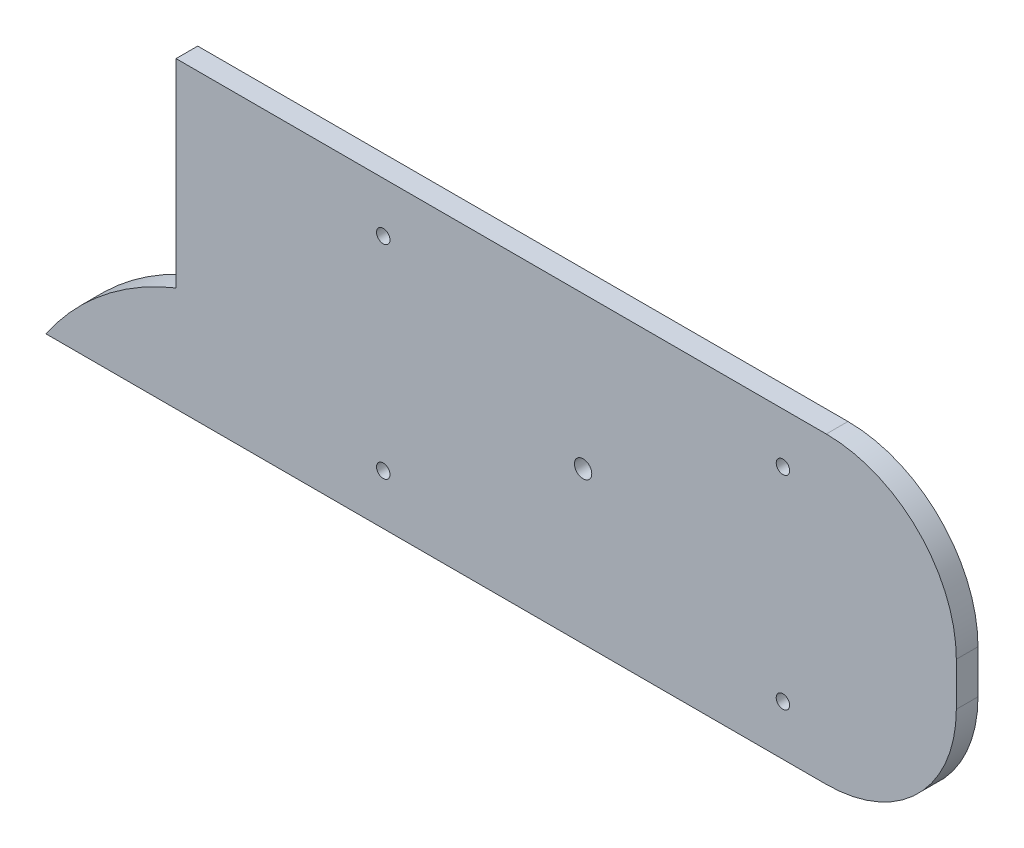
from build123d import *

# Parameters (mm, degrees)
BOSS_EXTRUDE1_DEPTH = 12.7
SKETCH4_R           = 5.08
SKETCH4_R_2         = 3.937
CUT_EXTRUDE2_DEPTH  = 563.396381567


with BuildPart() as part:
    # Sketch2 → Boss-Extrude1 (new body)
    with BuildSketch(Plane.XY):
        with BuildLine():
            Line((0, 0), (457.2, 0))
            ThreePointArc((457.2, 0), (511.081536726, 22.318463274), (533.4, 76.2))
            Line((533.4, 76.2), (533.4, 101.6))
            ThreePointArc((533.4, 101.6), (511.081536726, 155.481536726), (457.2, 177.8))
            Line((457.2, 177.8), (152.4, 177.8))
            Line((152.4, 177.8), (76.2, 177.8))
            Line((76.2, 177.8), (76.2, 61.401251199))
            ThreePointArc((76.2, 61.401251199), (33.506060073, 36.401783403), (0, 0))
        make_face()
    extrude(amount=BOSS_EXTRUDE1_DEPTH)

    # Sketch4 → Cut-Extrude2 (cut, through all)
    with BuildSketch(Plane.XY.offset(12.7)):
        with Locations((314.706, 88.9)):
            Circle(SKETCH4_R)
        with Locations((431.8, 148.4376)):
            Circle(SKETCH4_R_2)
        with Locations((197.612, 148.4376)):
            Circle(SKETCH4_R_2)
        with Locations((197.612, 29.3624)):
            Circle(SKETCH4_R_2)
        with Locations((431.8, 29.3624)):
            Circle(SKETCH4_R_2)
    extrude(amount=-CUT_EXTRUDE2_DEPTH, mode=Mode.SUBTRACT)


solid = part.part
